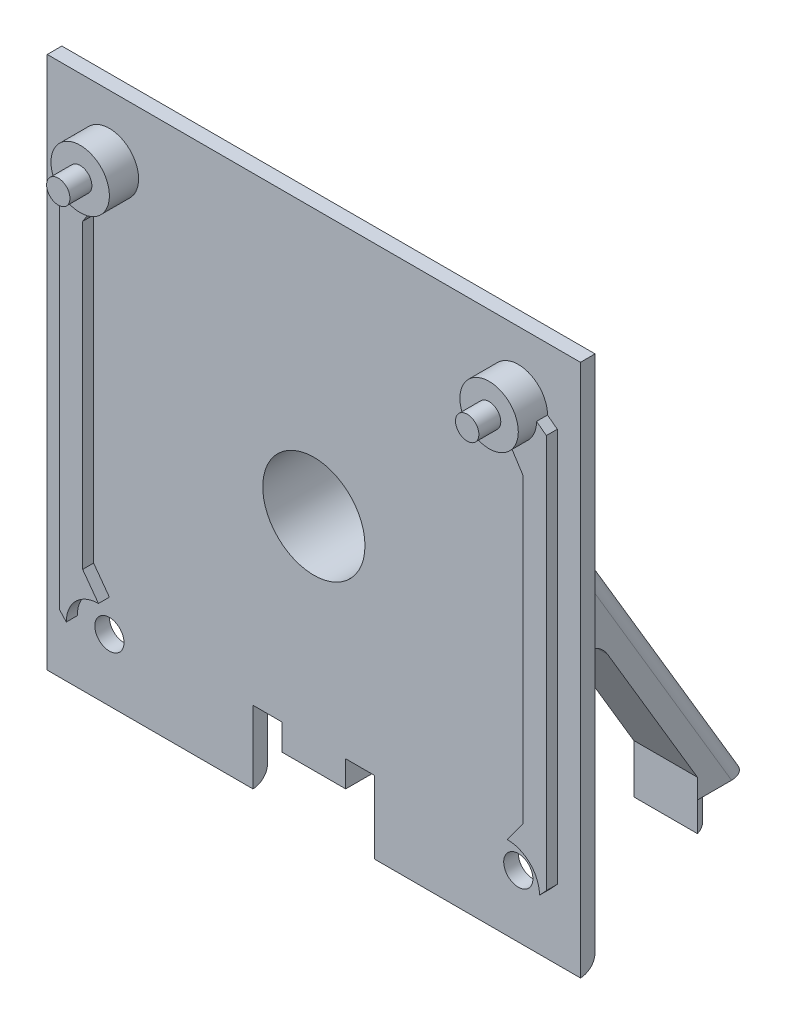
from build123d import *

# Parameters (mm, degrees)
EXTRUDE1_DEPTH       = 1
SKETCH2_R            = 2.0000000000000036
SKETCH2_R_2          = 2.000000000000001
EXTRUDE2_DEPTH       = 2
EXTRUDE3_DEPTH       = 0.75
SKETCH4_R            = 0.9999999999999981
SKETCH4_R_2          = 0.9999999999999998
EXTRUDE4_DEPTH       = 52.67519049311769
SKETCH5_R            = 0.800000000000003
SKETCH5_R_2          = 0.8000000000000015
EXTRUDE5_DEPTH       = 1.5
EXTRUDE6_DEPTH       = 52.83218413785011
SKETCH7_W            = 4.362500000000001
SKETCH7_H            = 3.0000000000000013
EXTRUDE7_DEPTH       = 19
EXTRUDE8_DEPTH       = 46.95491336625498
EXTRUDE9_DEPTH       = 17
EXTRUDE9_DEPTH_BACK  = 36
SKETCH9_W            = 4.362500000000001
SKETCH9_H            = 2.3206120824820307
SKETCH10_W           = 6.349999999999998
SKETCH10_H           = 3.475000000000003
EXTRUDE10_DEPTH      = 50.80993243420719
SKETCH11_R           = 4.500000000000002
EXTRUDE11_DEPTH      = 12
EXTRUDE12_START      = -4.2
EXTRUDE12_DEPTH      = 4.2
EXTRUDE13_DEPTH      = 4.5
EXTRUDE13_DEPTH_BACK = 50.57488155832686
SKETCH15_R           = 3.4999999999999996
EXTRUDE14_DEPTH      = 7.5
SKETCH16_R           = 0.49999999999999917
EXTRUDE15_DEPTH      = 0.3
EXTRUDE16_DEPTH      = 2
EXTRUDE17_DEPTH      = 5
EXTRUDE18_DEPTH      = 50.574881558326865
FILLET2_R            = 1
FILLET3_R            = 2
EXTRUDE19_DEPTH      = 4.3625


with BuildPart() as part:
    # Sketch1 → Extrude1 (new body)
    with BuildSketch(Plane.XY):
        Polygon((0, 0), (36.5125, 0), (36.512499999999996, 36.512499999999996), (0, 36.5125), align=None)
    extrude(amount=EXTRUDE1_DEPTH)

    # Sketch2 → Extrude2 (add)
    with BuildSketch(Plane.XY.offset(1)):
        with Locations((32.25625, 32.25625)):
            Circle(SKETCH2_R)
        with Locations((4.25625, 32.25625)):
            Circle(SKETCH2_R_2)
    extrude(amount=EXTRUDE2_DEPTH)

    # Sketch3 → Extrude3 (add)
    with BuildSketch(Plane.XY.offset(1)):
        with BuildLine():
            Line((1.5875, 4.762499999999999), (1.5875, 31.75))
            Line((1.5875, 31.75), (2.256249999999998, 32.25625))
            Line((2.256249999999998, 32.25625), (4.25625, 30.256249999999998))
            Line((4.25625, 30.256249999999998), (3.175, 28.575))
            Line((3.175, 28.575), (3.175, 7.9375))
            Line((3.175, 7.9375), (4.256250000000003, 6.456250000000007))
            ThreePointArc((4.256250000000003, 6.456250000000007), (2.7006150813895986, 5.811884918610412), (2.0562500000000026, 4.256250000000007))
            Line((2.0562500000000026, 4.256250000000007), (1.5875, 4.762499999999999))
        make_face()
        with BuildLine():
            Line((34.925, 4.762499999999999), (34.925, 31.75))
            Line((34.925, 31.75), (34.25625, 32.25625))
            Line((34.25625, 32.25625), (32.25625, 30.256249999999998))
            Line((32.25625, 30.256249999999998), (33.3375, 28.575))
            Line((33.3375, 28.575), (33.3375, 7.9375))
            Line((33.3375, 7.9375), (32.25625000000001, 6.456249999999997))
            ThreePointArc((32.25625000000001, 6.456249999999997), (33.81188491861041, 5.811884918610402), (34.456250000000004, 4.256249999999998))
            Line((34.456250000000004, 4.256249999999998), (34.925, 4.762499999999999))
        make_face()
    extrude(amount=EXTRUDE3_DEPTH)

    # Sketch4 → Extrude4 (cut, through all)
    with BuildSketch(Plane.XY.offset(1)):
        with Locations((32.25625, 4.256249999999997)):
            Circle(SKETCH4_R)
        with Locations((4.256250000000007, 4.256250000000004)):
            Circle(SKETCH4_R_2)
    extrude(amount=-EXTRUDE4_DEPTH, mode=Mode.SUBTRACT)

    # Sketch5 → Extrude5 (add)
    with BuildSketch(Plane.XY.offset(3)):
        with Locations((32.25625, 32.25625)):
            Circle(SKETCH5_R)
        with Locations((4.25625, 32.25625)):
            Circle(SKETCH5_R_2)
    extrude(amount=EXTRUDE5_DEPTH)

    # Sketch6 → Extrude6 (cut, through all)
    with BuildSketch(Plane(origin=(0, 0, 0), x_dir=(-1, 0, 0), z_dir=(0, 0, -1))):
        Polygon((-22.425, 0), (-22.425, 4.9625), (-20.4375, 4.9625), (-20.4375, 3.175), (-16.075, 3.175), (-16.075, 4.9625), (-14.0875, 4.9625), (-14.0875, 0), align=None)
    extrude(amount=-EXTRUDE6_DEPTH, mode=Mode.SUBTRACT)

    # Sketch7 → Extrude7 (add)
    with BuildSketch(Plane(origin=(0, 0, 0), x_dir=(-1, 0, 0), z_dir=(0, 0, -1))):
        with Locations((-18.25625, 4.675)):
            Rectangle(SKETCH7_W, SKETCH7_H)
    extrude(amount=EXTRUDE7_DEPTH)

    # Sketch8 → Extrude8 (cut, through all)
    with BuildSketch(Plane(origin=(20.4375, 0, 0), x_dir=(0, 0, -1), z_dir=(1, 0, 0))):
        Polygon((19, 4.748611530779532), (19, 0), (11, -9.8e-16), align=None)
    extrude(amount=-EXTRUDE8_DEPTH, mode=Mode.SUBTRACT)

    # Sketch9 → Extrude9 (add, two sides: drawn at the far end of the back side and taken through both)
    with BuildSketch(Plane(origin=(0, -4.828204957496708, -2.8659087167669712), x_dir=(1, 0, 0), z_dir=(0, -0.8599202544016947, -0.5104284044503447)).offset(-EXTRUDE9_DEPTH_BACK)):
        with Locations((18.25625, -16.839693958758986)):
            Rectangle(SKETCH9_W, SKETCH9_H)
    extrude(amount=EXTRUDE9_DEPTH + EXTRUDE9_DEPTH_BACK)

    # Sketch10 → Extrude10 (cut, through all)
    with BuildSketch(Plane(origin=(20.4375, 0, 0), x_dir=(0, 0, -1), z_dir=(1, 0, 0))):
        with Locations((25.4, -11.2625)):
            Rectangle(SKETCH10_W, SKETCH10_H)
    extrude(amount=-EXTRUDE10_DEPTH, mode=Mode.SUBTRACT)

    # Sketch11 → Extrude11 (add)
    with BuildSketch(Plane(origin=(0, 0, 0), x_dir=(-1, 0, 0), z_dir=(0, 0, -1))):
        with Locations(Location((-18.25625, 18.25625, 0), (0, 0, 180))):
            Circle(SKETCH11_R)
    extrude(amount=EXTRUDE11_DEPTH)

    # Sketch12 → Extrude12 (cut)
    with BuildSketch(Plane(origin=(0, 0, -12), x_dir=(-1, 0, 0), z_dir=(0, 0, -1)).offset(EXTRUDE12_START)):
        with BuildLine():
            Line((-22.75625, 18.25625), (-21.25625, 18.25625))
            ThreePointArc((-21.25625, 18.25625), (-18.25625, 15.256250000000001), (-15.256250000000003, 18.25625))
            Line((-15.256250000000003, 18.25625), (-13.756250000000001, 18.25625))
            ThreePointArc((-13.756250000000001, 18.25625), (-18.25625, 22.75625), (-22.75625, 18.25625))
        make_face()
    extrude(amount=EXTRUDE12_DEPTH, mode=Mode.SUBTRACT)

    # Sketch13 → Extrude13 (cut, two sides: drawn at the far end of the back side and taken through both)
    with BuildSketch(Plane.ZY.offset(-16.075).offset(-EXTRUDE13_DEPTH_BACK)):
        Polygon((-6.511482510112533, 24.294581169959557), (-19.744999641447297, 2.000035413908037), (-19.744999641447297, 23.38214880236955), align=None)
    extrude(amount=EXTRUDE13_DEPTH + EXTRUDE13_DEPTH_BACK, mode=Mode.SUBTRACT)

    # Sketch15 → Extrude14 (cut)
    with BuildSketch(Plane.XY.offset(1)):
        with Locations((18.256250000000005, 18.256249999999998)):
            Circle(SKETCH15_R)
    extrude(amount=-EXTRUDE14_DEPTH, mode=Mode.SUBTRACT)

    # Sketch16 → Extrude15 (cut)
    with BuildSketch(Plane.XY.offset(-6.5)):
        with Locations((18.256250000000005, 18.256249999999998)):
            Circle(SKETCH16_R)
    extrude(amount=-EXTRUDE15_DEPTH, mode=Mode.SUBTRACT)



with BuildPart() as body_2:
    # Sketch17 → Extrude16 (new body)
    with BuildSketch(Plane.XZ.offset(9.524999999999999)):
        with BuildLine():
            Line((16.075, -23.090021330000003), (20.43750000000001, -23.090021330000003))
            ThreePointArc((20.43750000000001, -23.090021330000003), (18.256250000000005, -24.680840302005432), (16.075, -23.090021330000003))
        make_face()
    extrude(amount=EXTRUDE16_DEPTH)


with BuildPart() as part_1:
    add(part.part)

    add(body_2.part)  # Extrude17 merges body 2
    # Sketch18 → Extrude17 (add)
    with BuildSketch(Plane.XZ.offset(9.524999999999999)):
        Polygon((20.4375, -26.585989148838085), (20.43750000000001, -23.090021330000003), (16.075, -23.090021330000003), (16.075, -26.585989148838067), align=None)
    extrude(amount=-EXTRUDE17_DEPTH)

    # Sketch19 → Extrude18 (cut, through all)
    with BuildSketch(Plane(origin=(20.4375, 0, 0), x_dir=(0, 0, -1), z_dir=(1, 0, 0))):
        Polygon((19.073875811639994, 3.1306797303903946), (28.233881236807996, -12.301208712443408), (26.987499999999997, 3.175), align=None)
    extrude(amount=-EXTRUDE18_DEPTH, mode=Mode.SUBTRACT)

    # Fillet2
    # the kernel refuses this fillet: 1 mm, written as the material it adds along each edge
    # the kernel refuses this fillet: 1 mm, written as the material it takes off along each edge
    with BuildSketch(Plane(origin=(20.4375, 37.41429579940197, 1.276071011125861), x_dir=(-1, 3.9e-16, -6.6e-16), z_dir=(0, -0.8599202544016947, -0.5104284044503447))) as fillet2_2_piece_1_section:
        with BuildLine():
            CenterArc((FILLET2_R, -FILLET2_R), FILLET2_R, 89.99999999999996, 90.00000000000004)
            Line((-7.6e-16, -FILLET2_R), (0, 0))
            Line((0, 0), (FILLET2_R, 0))
        make_face()
    fillet2_2_piece_1 = extrude(amount=20.201686941576707, mode=Mode.PRIVATE)
    fillet2_2_piece_1 = fillet2_2_piece_1 - Plane(origin=(18.25625, 18.25625, -3.719487520813402), x_dir=(1, 1.2e-16, 0), z_dir=(0, 0, 1)) * Cylinder(4.500000000000002, 45, mode=Mode.PRIVATE)
    fillet2_2_piece_1 = split(fillet2_2_piece_1, bisect_by=Plane(origin=(20.212177439372237, 28.569917833815104, 0), z_dir=(0, 0, -1)), keep=Keep.TOP, mode=Mode.PRIVATE)
    add(fillet2_2_piece_1, mode=Mode.SUBTRACT)
    with BuildSketch(Plane(origin=(20.4375, -11.674800636004225, -27.86206015996393), x_dir=(0, -0.5104284044503445, 0.8599202544016947), z_dir=(0, 0.8599202544016948, 0.5104284044503447))) as fillet2_2_piece_2_section:
        with BuildLine():
            CenterArc((FILLET2_R, -FILLET2_R), FILLET2_R, 90, 90)
            Line((-2.15e-15, -FILLET2_R), (0, 0))
            Line((0, 0), (FILLET2_R, 0))
        make_face()
    fillet2_2_piece_2 = extrude(amount=33.575974655142886, mode=Mode.PRIVATE)
    fillet2_2_piece_2 = split(fillet2_2_piece_2, bisect_by=Plane(origin=(20.21436970343455, 2.314941596078876, -12), z_dir=(0, 0, -1)), keep=Keep.TOP, mode=Mode.PRIVATE)
    add(fillet2_2_piece_2, mode=Mode.SUBTRACT)
    with BuildSketch(Plane(origin=(20.4375, -11.674800636004225, -27.86206015996393), x_dir=(0, -0.5104284044503445, 0.8599202544016947), z_dir=(0, 0.8599202544016948, 0.5104284044503447))) as fillet2_2_piece_3_section:
        with BuildLine():
            CenterArc((FILLET2_R, -FILLET2_R), FILLET2_R, 90, 90)
            Line((-2.15e-15, -FILLET2_R), (0, 0))
            Line((0, 0), (FILLET2_R, 0))
        make_face()
    fillet2_2_piece_3 = extrude(amount=33.575974655142886, mode=Mode.PRIVATE)
    fillet2_2_piece_3 = fillet2_2_piece_3 - Plane(origin=(18.25625, 18.25625, -11.853054831644428), x_dir=(1, 1.2e-16, 0), z_dir=(0, 0, 1)) * Cylinder(4.500000000000002, 72, mode=Mode.PRIVATE)
    add(fillet2_2_piece_3, mode=Mode.SUBTRACT)
    with BuildSketch(Plane(origin=(16.075, 37.41429579940197, 1.276071011125861), x_dir=(1, 3.9e-16, -6.6e-16), z_dir=(0, -0.8599202544016947, -0.5104284044503447))) as fillet2_2_piece_4_section:
        with BuildLine():
            CenterArc((FILLET2_R, FILLET2_R), FILLET2_R, 180, 90.00000000000006)
            Line((-7.6e-16, FILLET2_R), (0, 0))
            Line((0, 0), (FILLET2_R, 0))
        make_face()
    fillet2_2_piece_4 = extrude(amount=20.201686941576707, mode=Mode.PRIVATE)
    fillet2_2_piece_4 = fillet2_2_piece_4 - Plane(origin=(18.25625, 18.25625, -3.71949003584698), x_dir=(1, 1.2e-16, 0), z_dir=(0, 0, 1)) * Cylinder(4.500000000000002, 45, mode=Mode.PRIVATE)
    fillet2_2_piece_4 = split(fillet2_2_piece_4, bisect_by=Plane(origin=(16.300322795564288, 28.56991314804096, 0), z_dir=(0, 0, -1)), keep=Keep.TOP, mode=Mode.PRIVATE)
    add(fillet2_2_piece_4, mode=Mode.SUBTRACT)
    with BuildSketch(Plane(origin=(16.075, 17.197860031231095, -10.723928988874135), x_dir=(0, -0.5104284044503445, 0.8599202544016947), z_dir=(0, -0.8599202544016948, -0.5104284044503447))) as fillet2_2_piece_5_section:
        with BuildLine():
            CenterArc((FILLET2_R, -FILLET2_R), FILLET2_R, 90, 90)
            Line((-2.9e-16, -FILLET2_R), (0, 0))
            Line((0, 0), (FILLET2_R, 0))
        make_face()
    fillet2_2_piece_5 = extrude(amount=33.5759746551429, mode=Mode.PRIVATE)
    fillet2_2_piece_5 = split(fillet2_2_piece_5, bisect_by=Plane(origin=(16.399463784438982, 14.506186202544315, -12), z_dir=(0, 0, -1)), keep=Keep.TOP, mode=Mode.PRIVATE)
    add(fillet2_2_piece_5, mode=Mode.SUBTRACT)
    with BuildSketch(Plane(origin=(16.075, 17.197860031231095, -10.723928988874135), x_dir=(0, -0.5104284044503445, 0.8599202544016947), z_dir=(0, -0.8599202544016948, -0.5104284044503447))) as fillet2_2_piece_6_section:
        with BuildLine():
            CenterArc((FILLET2_R, -FILLET2_R), FILLET2_R, 90, 90)
            Line((-2.9e-16, -FILLET2_R), (0, 0))
            Line((0, 0), (FILLET2_R, 0))
        make_face()
    fillet2_2_piece_6 = extrude(amount=33.5759746551429, mode=Mode.PRIVATE)
    fillet2_2_piece_6 = fillet2_2_piece_6 - Plane(origin=(18.25625, 18.25625, -11.853054833536454), x_dir=(1, 1.2e-16, 0), z_dir=(0, 0, 1)) * Cylinder(4.500000000000002, 72, mode=Mode.PRIVATE)
    add(fillet2_2_piece_6, mode=Mode.SUBTRACT)
    with BuildSketch(Plane(origin=(-2.5000000000000004, 0, 0), x_dir=(0, 0, 1), z_dir=(1, 0, 0)), Plane(origin=(19.925, 0, 0), x_dir=(0, 0, 1), z_dir=(1, 0, 0))) as fillet2_2_piece_7:
        with BuildLine():
            CenterArc((FILLET2_R, -FILLET2_R), FILLET2_R, 90, 90)
            Line((-1.1e-16, -FILLET2_R), (0, 0))
            Line((0, 0), (FILLET2_R, 0))
        make_face()
    extrude(amount=19.087500000000002, mode=Mode.SUBTRACT)

    # Fillet3
    # the kernel refuses this fillet: 2 mm, written as the material it adds along each edge
    with BuildSketch(Plane(origin=(16.075, 4.9625, 0), x_dir=(0, 0, -1), z_dir=(0, 1, 0)), Plane(origin=(20.4375, 6.175, 0), x_dir=(0, 0, -1), z_dir=(0, -1, 0))) as fillet3_piece_1:
        with BuildLine():
            CenterArc((FILLET3_R, FILLET3_R), FILLET3_R, 180, 90)
            Line((-2.2e-16, FILLET3_R), (-FILLET3_R * 0.02, FILLET3_R))
            Line((-FILLET3_R * 0.02, FILLET3_R), (-FILLET3_R * 0.02, -FILLET3_R * 0.02))
            Line((-FILLET3_R * 0.02, -FILLET3_R * 0.02), (FILLET3_R, -FILLET3_R * 0.02))
            Line((FILLET3_R, -FILLET3_R * 0.02), (FILLET3_R, 0))
        make_face()
    extrude(amount=1.2124999999999995)
    with BuildSketch(Plane(origin=(16.075, 6.175, 0), x_dir=(0, 1, 0), z_dir=(1, 0, 0))) as fillet3_piece_2:
        with BuildLine():
            CenterArc((FILLET3_R, -FILLET3_R), FILLET3_R, 90, 90)
            Line((-8.9e-16, -FILLET3_R), (-FILLET3_R * 0.02, -FILLET3_R))
            Line((-FILLET3_R * 0.02, -FILLET3_R), (-FILLET3_R * 0.02, FILLET3_R * 0.02))
            Line((-FILLET3_R * 0.02, FILLET3_R * 0.02), (FILLET3_R, FILLET3_R * 0.02))
            Line((FILLET3_R, FILLET3_R * 0.02), (FILLET3_R, 0))
        make_face()
    extrude(amount=4.362500000000001)
    with BuildSketch(Plane(origin=(16.075, 3.175000000000001, -16.34893196366189), x_dir=(0, -1.17e-15, 1), z_dir=(1, 0, 0))) as fillet3_piece_3:
        with BuildLine():
            CenterArc((FILLET3_R * 0.569322088931, FILLET3_R), FILLET3_R, 210.69236976062953, 59.30763023937038)
            Line((-FILLET3_R * 0.290598165471, FILLET3_R * 0.48957159555), (-FILLET3_R * 0.307796570559, FILLET3_R * 0.479363027461))
            Line((-FILLET3_R * 0.307796570559, FILLET3_R * 0.479363027461), (-FILLET3_R * 0.0113864417786, -FILLET3_R * 0.02))
            Line((-FILLET3_R * 0.0113864417786, -FILLET3_R * 0.02), (FILLET3_R * 0.569322088931, -FILLET3_R * 0.02))
            Line((FILLET3_R * 0.569322088931, -FILLET3_R * 0.02), (FILLET3_R * 0.569322088931, 0))
        make_face()
    extrude(amount=4.362500000000001)
    with BuildSketch(Plane(origin=(20.4375, 6.175000000000001, -14.568202639619555), x_dir=(0, 0.8599202544016946, 0.5104284044503449), z_dir=(-1, 0, 0))) as fillet3_piece_4:
        with BuildLine():
            CenterArc((FILLET3_R * 1.75647497163, -FILLET3_R), FILLET3_R, 90.00000000000006, 120.6923697606295)
            Line((FILLET3_R * 0.896554717224, -FILLET3_R * 1.51042840445), (FILLET3_R * 0.879356312136, -FILLET3_R * 1.52063697254))
            Line((FILLET3_R * 0.879356312136, -FILLET3_R * 1.52063697254), (-FILLET3_R * 0.017198405088, -FILLET3_R * 0.010208568089))
            Line((-FILLET3_R * 0.017198405088, -FILLET3_R * 0.010208568089), (1.4e-16, FILLET3_R * 0.02))
            Line((1.4e-16, FILLET3_R * 0.02), (FILLET3_R * 1.75647497163, FILLET3_R * 0.02))
            Line((FILLET3_R * 1.75647497163, FILLET3_R * 0.02), (FILLET3_R * 1.75647497163, 0))
        make_face()
    extrude(amount=4.362500000000001)
    with BuildSketch(Plane(origin=(16.075, 4.9625, 0), x_dir=(0, 0, -1), z_dir=(0, 1, 0))) as fillet3_piece_5a_section:
        with BuildLine():
            CenterArc((FILLET3_R, FILLET3_R), FILLET3_R, 180, 90)
            Line((-2.2e-16, FILLET3_R), (-FILLET3_R * 0.02, FILLET3_R))
            Line((-FILLET3_R * 0.02, FILLET3_R), (-FILLET3_R * 0.02, -FILLET3_R * 0.02))
            Line((-FILLET3_R * 0.02, -FILLET3_R * 0.02), (FILLET3_R, -FILLET3_R * 0.02))
            Line((FILLET3_R, -FILLET3_R * 0.02), (FILLET3_R, 0))
        make_face()
    fillet3_piece_5a = extrude(amount=6.2125, mode=Mode.PRIVATE)
    fillet3_piece_5a = split(fillet3_piece_5a, bisect_by=Plane(origin=(15.622209771466347, 6.175, -0.45279022853364964), z_dir=(0, 1, 0)), keep=Keep.TOP, mode=Mode.PRIVATE)
    with BuildSketch(Plane(origin=(11.075, 6.175000000000001, 0), x_dir=(0, 1, 0), z_dir=(1, 0, 0))) as fillet3_piece_5b_section:
        with BuildLine():
            CenterArc((FILLET3_R, -FILLET3_R), FILLET3_R, 90, 90)
            Line((0, -FILLET3_R), (-FILLET3_R * 0.02, -FILLET3_R))
            Line((-FILLET3_R * 0.02, -FILLET3_R), (-FILLET3_R * 0.02, FILLET3_R * 0.02))
            Line((-FILLET3_R * 0.02, FILLET3_R * 0.02), (FILLET3_R, FILLET3_R * 0.02))
            Line((FILLET3_R, FILLET3_R * 0.02), (FILLET3_R, 0))
        make_face()
    fillet3_piece_5b = extrude(amount=9.3625, mode=Mode.PRIVATE)
    fillet3_piece_5b = split(fillet3_piece_5b, bisect_by=Plane(origin=(16.075, 6.627790228533651, -0.4527902285336509), z_dir=(-1, 0, 0)), keep=Keep.TOP, mode=Mode.PRIVATE)
    fillet3_piece_5 = fillet3_piece_5a & fillet3_piece_5b
    add(fillet3_piece_5)
    with BuildSketch(Plane(origin=(20.4375, 11.175, 0), x_dir=(0, 0, -1), z_dir=(0, -1, 0))) as fillet3_piece_6a_section:
        with BuildLine():
            CenterArc((FILLET3_R, FILLET3_R), FILLET3_R, 180, 90)
            Line((-2.2e-16, FILLET3_R), (-FILLET3_R * 0.02, FILLET3_R))
            Line((-FILLET3_R * 0.02, FILLET3_R), (-FILLET3_R * 0.02, -FILLET3_R * 0.02))
            Line((-FILLET3_R * 0.02, -FILLET3_R * 0.02), (FILLET3_R, -FILLET3_R * 0.02))
            Line((FILLET3_R, -FILLET3_R * 0.02), (FILLET3_R, 0))
        make_face()
    fillet3_piece_6a = extrude(amount=6.2125, mode=Mode.PRIVATE)
    fillet3_piece_6a = split(fillet3_piece_6a, bisect_by=Plane(origin=(20.89029022853365, 6.175, -0.45279022853364964), z_dir=(0, 1, 0)), keep=Keep.TOP, mode=Mode.PRIVATE)
    with BuildSketch(Plane(origin=(16.075, 6.175, 0), x_dir=(0, 1, 0), z_dir=(1, 0, 0))) as fillet3_piece_6b_section:
        with BuildLine():
            CenterArc((FILLET3_R, -FILLET3_R), FILLET3_R, 90, 90)
            Line((-8.9e-16, -FILLET3_R), (-FILLET3_R * 0.02, -FILLET3_R))
            Line((-FILLET3_R * 0.02, -FILLET3_R), (-FILLET3_R * 0.02, FILLET3_R * 0.02))
            Line((-FILLET3_R * 0.02, FILLET3_R * 0.02), (FILLET3_R, FILLET3_R * 0.02))
            Line((FILLET3_R, FILLET3_R * 0.02), (FILLET3_R, 0))
        make_face()
    fillet3_piece_6b = extrude(amount=9.3625, mode=Mode.PRIVATE)
    fillet3_piece_6b = split(fillet3_piece_6b, bisect_by=Plane(origin=(20.4375, 6.627790228533651, -0.4527902285336507), z_dir=(1, 0, 0)), keep=Keep.TOP, mode=Mode.PRIVATE)
    fillet3_piece_6 = fillet3_piece_6a & fillet3_piece_6b
    add(fillet3_piece_6)

    # Sketch20 → Extrude19 (cut)
    with BuildSketch(Plane.ZY.offset(-16.075)):
        Polygon((0.9999999999999991, 34.74142979383808), (1, 32.40279739081142), (2.0264905965505267, 34.13212915846101), align=None)
    extrude(amount=-EXTRUDE19_DEPTH, mode=Mode.SUBTRACT)


solid = part_1.part
